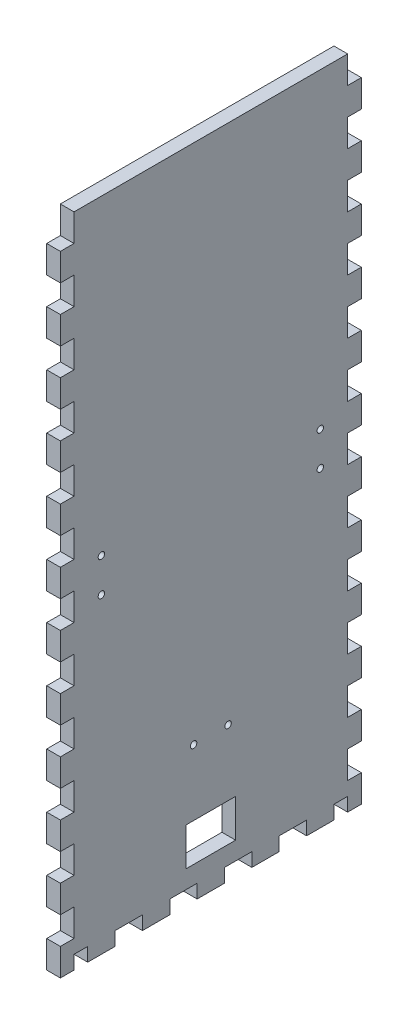
from build123d import *

# Parameters (mm, degrees)
SKETCH1_W              = 273.05
SKETCH1_H              = 139.7
BOSS_EXTRUDE1_DEPTH    = 6.35
SKETCH2_W              = 273.05
SKETCH2_H              = 139.7
SKETCH2_W_2            = 260.35
SKETCH2_H_2            = 127
BOSS_EXTRUDE2_DEPTH    = 298.45
SKETCH3_W              = 6.35
SKETCH3_H              = 16.933333333
SKETCH3_H_2            = 16.933333334
DOOR_SLOT_DEPTH        = 12.7
DOOR_GUIDE_HOLES_REACH = 361.617
SKETCH4_W              = 6.35
SKETCH4_H              = 15.875
LEVER_HOLES_W          = 9.652
LEVER_HOLES_H          = 6.35
LEVER_HOLES_W_2        = 6.35
CUT_EXTRUDE1_DEPTH     = 363.019620497
CUT_EXTRUDE3_REACH     = 417.137
SKETCH8_R              = 3.175
SKETCH16_W             = 326.476778096
SKETCH16_H             = 315.233565403
CUT_EXTRUDE10_DEPTH    = 363.019620497
LEFT_RIGHT_W           = 6.35
LEFT_RIGHT_H           = 6.35
LEFT_RIGHT_W_2         = 12.7
LEFT_RIGHT_H_2         = 12.7
CUT_EXTRUDE11_DEPTH    = 416.136561869
SKETCH17_R             = 1.5
SKETCH17_W             = 23
SKETCH17_H             = 17.61800007
CUT_EXTRUDE12_DEPTH    = 313.765703043


with BuildPart() as part:
    # Sketch1 → Boss-Extrude1 (new body)
    with BuildSketch(Plane(origin=(0, 0, 0), x_dir=(1, 0, 0), z_dir=(0, 1, 0))):
        Rectangle(SKETCH1_W, SKETCH1_H)
    extrude(amount=BOSS_EXTRUDE1_DEPTH)

    # Sketch2 → Boss-Extrude2 (add)
    with BuildSketch(Plane(origin=(0, 6.35, 0), x_dir=(1, 0, 0), z_dir=(0, 1, 0))):
        Rectangle(SKETCH2_W, SKETCH2_H)
        Rectangle(SKETCH2_W_2, SKETCH2_H_2, mode=Mode.SUBTRACT)
    extrude(amount=BOSS_EXTRUDE2_DEPTH)

    # Sketch3 → Door Slot (cut)
    with BuildSketch(Plane.XY.offset(69.85)):
        with BuildLine():
            Line((-28.575, 283.21), (-28.575, 6.35))
            Line((-28.575, 6.35), (-21.971, 6.35))
            Line((-21.971, 6.35), (-21.971, 292.354))
            Line((-21.971, 292.354), (-41.529, 292.354))
            Line((-41.529, 292.354), (-41.529, 285.75))
            Line((-41.529, 285.75), (-31.115, 285.75))
            ThreePointArc((-31.115, 285.75), (-29.318948776, 285.006051224), (-28.575, 283.21))
        make_face()
        with Locations((-12.446, 80.433333334)):
            Rectangle(SKETCH3_W, SKETCH3_H)
        with Locations((-12.446, 50.8)):
            Rectangle(SKETCH3_W, SKETCH3_H_2)
        with Locations((-12.446, 21.166666667)):
            Rectangle(SKETCH3_W, SKETCH3_H)
    extrude(amount=-DOOR_SLOT_DEPTH, mode=Mode.SUBTRACT)

    # Sketch4 → Door Guide Holes (cut, up to next)
    with BuildSketch(Plane.XY.offset(-63.5), mode=Mode.PRIVATE) as door_guide_holes_sk1:
        with Locations((-44.704, 284.1625)):
            Rectangle(SKETCH4_W, SKETCH4_H)
    door_guide_holes_tool1 = extrude(door_guide_holes_sk1.sketch, amount=-DOOR_GUIDE_HOLES_REACH, mode=Mode.PRIVATE) & part.part
    # Sketch4 → Door Guide Holes (cut, up to next)
    with BuildSketch(Plane.XY.offset(-63.5), mode=Mode.PRIVATE) as door_guide_holes_sk2:
        with Locations((-44.704, 255.5875)):
            Rectangle(SKETCH4_W, SKETCH4_H)
    door_guide_holes_tool2 = extrude(door_guide_holes_sk2.sketch, amount=-DOOR_GUIDE_HOLES_REACH, mode=Mode.PRIVATE) & part.part
    # Sketch4 → Door Guide Holes (cut, up to next)
    with BuildSketch(Plane.XY.offset(-63.5), mode=Mode.PRIVATE) as door_guide_holes_sk3:
        with Locations((-44.704, 227.0125)):
            Rectangle(SKETCH4_W, SKETCH4_H)
    door_guide_holes_tool3 = extrude(door_guide_holes_sk3.sketch, amount=-DOOR_GUIDE_HOLES_REACH, mode=Mode.PRIVATE) & part.part
    # Sketch4 → Door Guide Holes (cut, up to next)
    with BuildSketch(Plane.XY.offset(-63.5), mode=Mode.PRIVATE) as door_guide_holes_sk4:
        with Locations((-44.704, 198.4375)):
            Rectangle(SKETCH4_W, SKETCH4_H)
    door_guide_holes_tool4 = extrude(door_guide_holes_sk4.sketch, amount=-DOOR_GUIDE_HOLES_REACH, mode=Mode.PRIVATE) & part.part
    # Sketch4 → Door Guide Holes (cut, up to next)
    with BuildSketch(Plane.XY.offset(-63.5), mode=Mode.PRIVATE) as door_guide_holes_sk5:
        with Locations((-44.704, 169.8625)):
            Rectangle(SKETCH4_W, SKETCH4_H)
    door_guide_holes_tool5 = extrude(door_guide_holes_sk5.sketch, amount=-DOOR_GUIDE_HOLES_REACH, mode=Mode.PRIVATE) & part.part
    # Sketch4 → Door Guide Holes (cut, up to next)
    with BuildSketch(Plane.XY.offset(-63.5), mode=Mode.PRIVATE) as door_guide_holes_sk6:
        with Locations((-44.704, 141.2875)):
            Rectangle(SKETCH4_W, SKETCH4_H)
    door_guide_holes_tool6 = extrude(door_guide_holes_sk6.sketch, amount=-DOOR_GUIDE_HOLES_REACH, mode=Mode.PRIVATE) & part.part
    # Sketch4 → Door Guide Holes (cut, up to next)
    with BuildSketch(Plane.XY.offset(-63.5), mode=Mode.PRIVATE) as door_guide_holes_sk7:
        with Locations((-44.704, 112.7125)):
            Rectangle(SKETCH4_W, SKETCH4_H)
    door_guide_holes_tool7 = extrude(door_guide_holes_sk7.sketch, amount=-DOOR_GUIDE_HOLES_REACH, mode=Mode.PRIVATE) & part.part
    # Sketch4 → Door Guide Holes (cut, up to next)
    with BuildSketch(Plane.XY.offset(-63.5), mode=Mode.PRIVATE) as door_guide_holes_sk8:
        with Locations((-44.704, 84.1375)):
            Rectangle(SKETCH4_W, SKETCH4_H)
    door_guide_holes_tool8 = extrude(door_guide_holes_sk8.sketch, amount=-DOOR_GUIDE_HOLES_REACH, mode=Mode.PRIVATE) & part.part
    # Sketch4 → Door Guide Holes (cut, up to next)
    with BuildSketch(Plane.XY.offset(-63.5), mode=Mode.PRIVATE) as door_guide_holes_sk9:
        with Locations((-44.704, 55.5625)):
            Rectangle(SKETCH4_W, SKETCH4_H)
    door_guide_holes_tool9 = extrude(door_guide_holes_sk9.sketch, amount=-DOOR_GUIDE_HOLES_REACH, mode=Mode.PRIVATE) & part.part
    # Sketch4 → Door Guide Holes (cut, up to next)
    with BuildSketch(Plane.XY.offset(-63.5), mode=Mode.PRIVATE) as door_guide_holes_sk10:
        with Locations((-44.704, 26.9875)):
            Rectangle(SKETCH4_W, SKETCH4_H)
    door_guide_holes_tool10 = extrude(door_guide_holes_sk10.sketch, amount=-DOOR_GUIDE_HOLES_REACH, mode=Mode.PRIVATE) & part.part
    door_guide_holes_1 = door_guide_holes_tool1.solids().sort_by_distance((-44.704, 284.1625, -63.5))[0]
    add(door_guide_holes_1, mode=Mode.SUBTRACT)
    door_guide_holes_2 = door_guide_holes_tool2.solids().sort_by_distance((-44.704, 255.5875, -63.5))[0]
    add(door_guide_holes_2, mode=Mode.SUBTRACT)
    door_guide_holes_3 = door_guide_holes_tool3.solids().sort_by_distance((-44.704, 227.0125, -63.5))[0]
    add(door_guide_holes_3, mode=Mode.SUBTRACT)
    door_guide_holes_4 = door_guide_holes_tool4.solids().sort_by_distance((-44.704, 198.4375, -63.5))[0]
    add(door_guide_holes_4, mode=Mode.SUBTRACT)
    door_guide_holes_5 = door_guide_holes_tool5.solids().sort_by_distance((-44.704, 169.8625, -63.5))[0]
    add(door_guide_holes_5, mode=Mode.SUBTRACT)
    door_guide_holes_6 = door_guide_holes_tool6.solids().sort_by_distance((-44.704, 141.2875, -63.5))[0]
    add(door_guide_holes_6, mode=Mode.SUBTRACT)
    door_guide_holes_7 = door_guide_holes_tool7.solids().sort_by_distance((-44.704, 112.7125, -63.5))[0]
    add(door_guide_holes_7, mode=Mode.SUBTRACT)
    door_guide_holes_8 = door_guide_holes_tool8.solids().sort_by_distance((-44.704, 84.1375, -63.5))[0]
    add(door_guide_holes_8, mode=Mode.SUBTRACT)
    door_guide_holes_9 = door_guide_holes_tool9.solids().sort_by_distance((-44.704, 55.5625, -63.5))[0]
    add(door_guide_holes_9, mode=Mode.SUBTRACT)
    door_guide_holes_10 = door_guide_holes_tool10.solids().sort_by_distance((-44.704, 26.9875, -63.5))[0]
    add(door_guide_holes_10, mode=Mode.SUBTRACT)
    door_guide_holes = door_guide_holes_1 + door_guide_holes_2 + door_guide_holes_3 + door_guide_holes_4 + door_guide_holes_5 + door_guide_holes_6 + door_guide_holes_7 + door_guide_holes_8 + door_guide_holes_9 + door_guide_holes_10  # Door Guide Holes as one shape, for the pattern or mirror that repeats it

    # Mirror1: Door Guide Holes across plane
    add(door_guide_holes.mirror(Plane.ZY.offset(31.75)), mode=Mode.SUBTRACT)

    # Lever Holes → Cut-Extrude1 (cut, through all)
    with BuildSketch(Plane.XY.offset(69.85)):
        with Locations((54.102, 28.575)):
            Rectangle(LEVER_HOLES_W, LEVER_HOLES_H)
        with Locations((39.3065, 15.875)):
            Rectangle(LEVER_HOLES_W_2, LEVER_HOLES_H)
        with Locations((68.8975, 15.875)):
            Rectangle(LEVER_HOLES_W_2, LEVER_HOLES_H)
    extrude(amount=-CUT_EXTRUDE1_DEPTH, mode=Mode.SUBTRACT)

    # Sketch8 → Cut-Extrude3 (cut, up to next)
    with BuildSketch(Plane.ZY.offset(136.525), mode=Mode.PRIVATE) as cut_extrude3_sk1:
        with Locations((0, 19.05)):
            Circle(SKETCH8_R)
    cut_extrude3_tool1 = extrude(cut_extrude3_sk1.sketch, amount=-CUT_EXTRUDE3_REACH, mode=Mode.PRIVATE) & part.part
    add(cut_extrude3_tool1.solids().sort_by_distance((-136.525, 19.05, 0))[0], mode=Mode.SUBTRACT)

    # Sketch16 → Cut-Extrude10 (cut, through all)
    with BuildSketch(Plane.XY.offset(69.85)):
        with Locations((-33.063389048, 147.183217299)):
            Rectangle(SKETCH16_W, SKETCH16_H)
    extrude(amount=-CUT_EXTRUDE10_DEPTH, mode=Mode.SUBTRACT)

    # Left/Right → Cut-Extrude11 (cut, through all)
    with BuildSketch(Plane.ZY.offset(136.525)):
        with Locations((60.325, 3.175)):
            Rectangle(LEFT_RIGHT_W, LEFT_RIGHT_H)
        with Locations((38.1, 3.175)):
            Rectangle(LEFT_RIGHT_W_2, LEFT_RIGHT_H)
        with Locations((66.675, 19.05)):
            Rectangle(LEFT_RIGHT_W, LEFT_RIGHT_H_2)
        with Locations((12.7, 3.175)):
            Rectangle(LEFT_RIGHT_W_2, LEFT_RIGHT_H)
        with Locations((66.675, 44.45)):
            Rectangle(LEFT_RIGHT_W, LEFT_RIGHT_H_2)
        with Locations((-12.7, 3.175)):
            Rectangle(LEFT_RIGHT_W_2, LEFT_RIGHT_H)
        with Locations((66.675, 69.85)):
            Rectangle(LEFT_RIGHT_W, LEFT_RIGHT_H_2)
        with Locations((-38.1, 3.175)):
            Rectangle(LEFT_RIGHT_W_2, LEFT_RIGHT_H)
        with Locations((66.675, 95.25)):
            Rectangle(LEFT_RIGHT_W, LEFT_RIGHT_H_2)
        with Locations((-60.325, 3.175)):
            Rectangle(LEFT_RIGHT_W, LEFT_RIGHT_H)
        with Locations((66.675, 120.65)):
            Rectangle(LEFT_RIGHT_W, LEFT_RIGHT_H_2)
        with Locations((-66.675, 19.05)):
            Rectangle(LEFT_RIGHT_W, LEFT_RIGHT_H_2)
        with Locations((66.675, 146.05)):
            Rectangle(LEFT_RIGHT_W, LEFT_RIGHT_H_2)
        with Locations((-66.675, 44.45)):
            Rectangle(LEFT_RIGHT_W, LEFT_RIGHT_H_2)
        with Locations((66.675, 171.45)):
            Rectangle(LEFT_RIGHT_W, LEFT_RIGHT_H_2)
        with Locations((-66.675, 69.85)):
            Rectangle(LEFT_RIGHT_W, LEFT_RIGHT_H_2)
        with Locations((66.675, 196.85)):
            Rectangle(LEFT_RIGHT_W, LEFT_RIGHT_H_2)
        with Locations((-66.675, 95.25)):
            Rectangle(LEFT_RIGHT_W, LEFT_RIGHT_H_2)
        with Locations((66.675, 222.25)):
            Rectangle(LEFT_RIGHT_W, LEFT_RIGHT_H_2)
        with Locations((-66.675, 120.65)):
            Rectangle(LEFT_RIGHT_W, LEFT_RIGHT_H_2)
        with Locations((66.675, 247.65)):
            Rectangle(LEFT_RIGHT_W, LEFT_RIGHT_H_2)
        with Locations((-66.675, 146.05)):
            Rectangle(LEFT_RIGHT_W, LEFT_RIGHT_H_2)
        with Locations((66.675, 273.05)):
            Rectangle(LEFT_RIGHT_W, LEFT_RIGHT_H_2)
        with Locations((-66.675, 171.45)):
            Rectangle(LEFT_RIGHT_W, LEFT_RIGHT_H_2)
        with Locations((66.675, 298.45)):
            Rectangle(LEFT_RIGHT_W, LEFT_RIGHT_H_2)
        with Locations((-66.675, 196.85)):
            Rectangle(LEFT_RIGHT_W, LEFT_RIGHT_H_2)
        with Locations((-66.675, 298.45)):
            Rectangle(LEFT_RIGHT_W, LEFT_RIGHT_H_2)
        with Locations((-66.675, 222.25)):
            Rectangle(LEFT_RIGHT_W, LEFT_RIGHT_H_2)
        with Locations((-66.675, 273.05)):
            Rectangle(LEFT_RIGHT_W, LEFT_RIGHT_H_2)
        with Locations((-66.675, 247.65)):
            Rectangle(LEFT_RIGHT_W, LEFT_RIGHT_H_2)
    extrude(amount=-CUT_EXTRUDE11_DEPTH, mode=Mode.SUBTRACT)

    # Sketch17 → Cut-Extrude12 (cut, through all)
    with BuildSketch(Plane(origin=(136.525, 0, 0), x_dir=(0, 0, -1), z_dir=(1, 0, 0))):
        with Locations((-8, 62.85)):
            Circle(SKETCH17_R)
        with Locations((8, 62.85)):
            Circle(SKETCH17_R)
        with Locations((-50.8, 160.275)):
            Circle(SKETCH17_R)
        with Locations((-50.8, 144.525)):
            Circle(SKETCH17_R)
        with Locations((50.8, 144.525)):
            Circle(SKETCH17_R)
        with Locations((50.8, 160.275)):
            Circle(SKETCH17_R)
        with Locations((0, 23.541000035)):
            Rectangle(SKETCH17_W, SKETCH17_H)
    extrude(amount=-CUT_EXTRUDE12_DEPTH, mode=Mode.SUBTRACT)


solid = part.part
